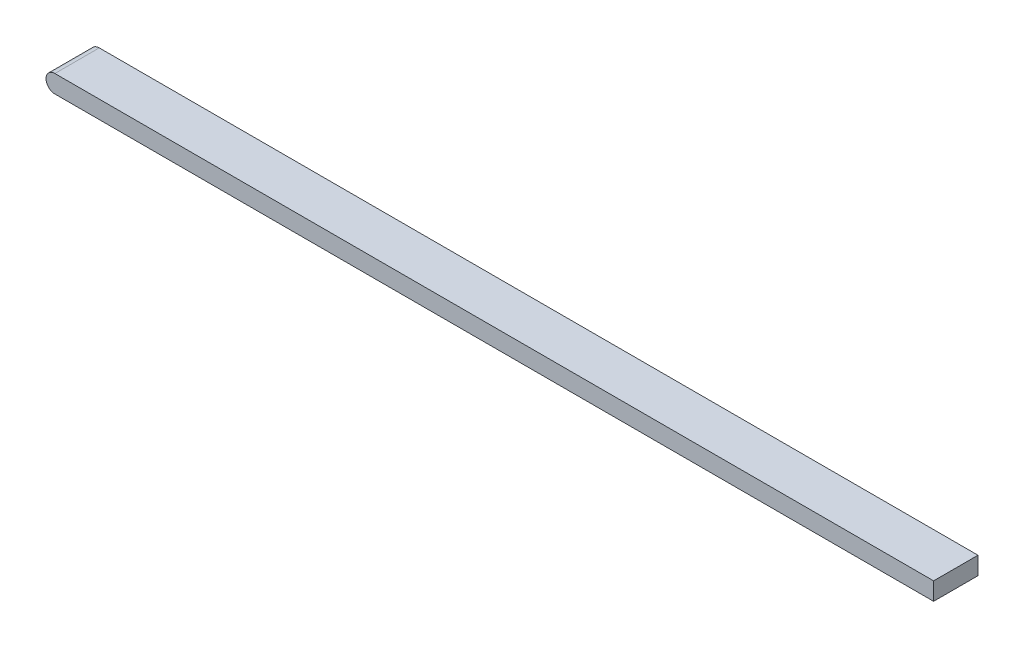
from build123d import *

# Parameters (mm, degrees)
SKETCH1_W           = 1000
SKETCH1_H           = 50
BOSS_EXTRUDE1_DEPTH = 20
FILLET1_R           = 10


with BuildPart() as part:
    # Sketch1 → Boss-Extrude1 (new body)
    with BuildSketch(Plane(origin=(0, 0, 0), x_dir=(1, 0, 0), z_dir=(0, 1, 0))):
        with Locations((500, 25)):
            Rectangle(SKETCH1_W, SKETCH1_H)
    extrude(amount=BOSS_EXTRUDE1_DEPTH)

    # Fillet1
    fillet1_edges = [part.edges().sort_by_distance(p)[0] for p in [
        (0, 0, -25),
        (0, 20, -25),
    ]]
    fillet(fillet1_edges, radius=FILLET1_R - 0.0001)  # a hair under: the kernel refuses the full size


solid = part.part
